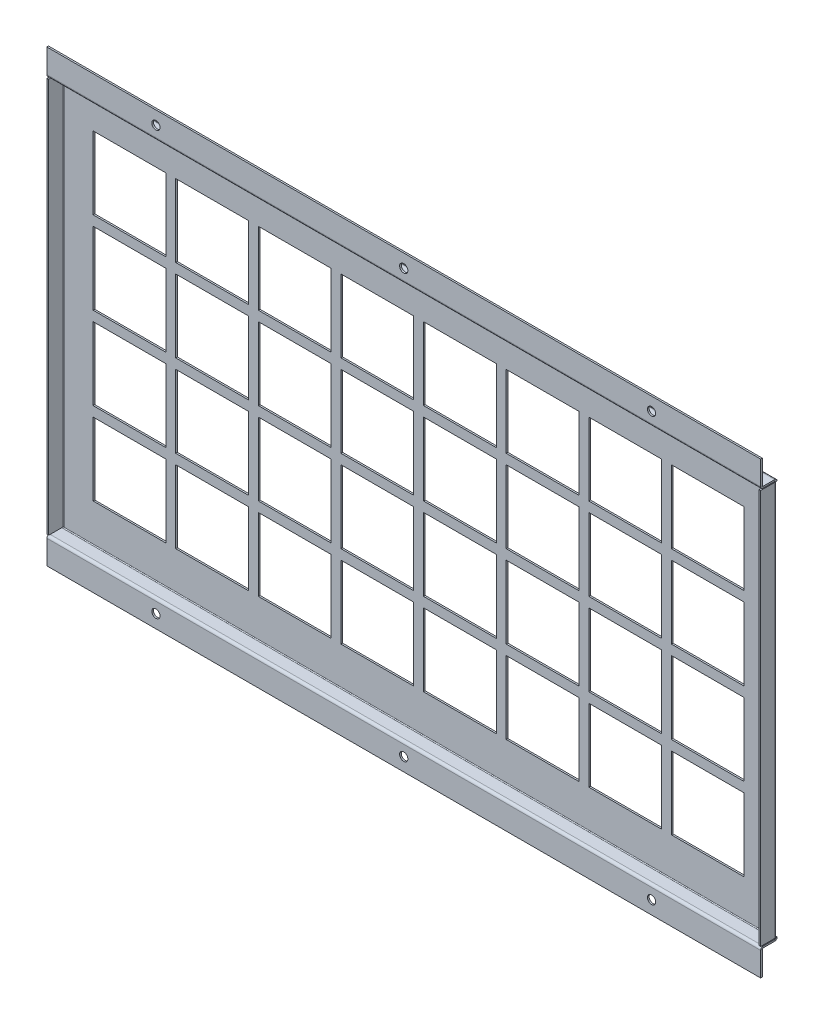
from build123d import *

# Parameters (mm, degrees)
SKETCH_1_W                       = 432
SKETCH_1_H                       = 242
SM_BASE_FLANGE_1_DEPTH           = 1
SKETCH_3_W                       = 44
SKETCH_3_H                       = 44
CUT_EXTRUDE_1_DEPTH              = 248.584329068
PATTERN_LINEAR_1_COUNT           = 8
PATTERN_LINEAR_1_PITCH           = 50
PATTERN_LINEAR_1_COUNT_DIR2      = 4
PATTERN_LINEAR_1_PITCH_DIR2      = 50
OTHER_START                      = -216
OTHER_1_DEPTH                    = 432
OTHER_1_2_DEPTH                  = 432
SKETCH_8_R                       = 2.5
CUT_EXTRUDE_2_DEPTH              = 256.407517509
SM_EDGE_FLANGE_1_STRIP_W         = 5
SM_EDGE_FLANGE_1_STRIP_H         = 1
SM_EDGE_FLANGE_1_STRIP_CUT_DEPTH = 239
SM_EDGE_FLANGE_1_DEPTH           = 239
SM_EDGE_FLANGE_2_STRIP_W         = 5
SM_EDGE_FLANGE_2_STRIP_H         = 1
SM_EDGE_FLANGE_2_STRIP_CUT_DEPTH = 239
SM_EDGE_FLANGE_2_DEPTH           = 239


# Read off the part's stored shape, not the designer's step: 斜接法兰1
# Sheet-metal steps are written as plain solids
with BuildPart() as part:
    # Sketch 1 → 基体-法兰1 (new body)
    with BuildSketch(Plane.XY):
        Rectangle(SKETCH_1_W, SKETCH_1_H)
    extrude(amount=-SM_BASE_FLANGE_1_DEPTH)

    # 草图3 → 切除-拉伸1 (cut, through all)
    with BuildSketch(Plane.XY):
        with Locations((-175, -74.98)):
            Rectangle(SKETCH_3_W, SKETCH_3_H)
    cut_extrude_1 = extrude(amount=-CUT_EXTRUDE_1_DEPTH, mode=Mode.SUBTRACT)

    # 阵列(线性)1: Cut-Extrude 1 8 × 4
    with Locations(*[(i * PATTERN_LINEAR_1_PITCH, j * PATTERN_LINEAR_1_PITCH_DIR2, 0) for i in range(PATTERN_LINEAR_1_COUNT) for j in range(PATTERN_LINEAR_1_COUNT_DIR2) if (i, j) != (0, 0)]):
        add(cut_extrude_1, mode=Mode.SUBTRACT)

    # Other 1 outline → Other 1 (cut)
    with BuildSketch(Plane.YZ.offset(OTHER_START)):
        with BuildLine():
            Line((121, 0), (120.914213563, 0))
            ThreePointArc((120.914213563, 0), (120.366025404, -0.724744872), (119.5, -1))
            Line((119.5, -1), (121, -1))
            Line((121, -1), (121, 0))
        make_face()
    other_1 = extrude(amount=OTHER_1_DEPTH, mode=Mode.SUBTRACT)

    # Other 1 2 outline → Other 1 2 (add)
    with BuildSketch(Plane.YZ.offset(OTHER_START)):
        with BuildLine():
            Line((121.5, 8), (136, 8))
            Line((136, 8), (136, 9))
            Line((136, 9), (121.5, 9))
            ThreePointArc((121.5, 9), (120.439339828, 8.560660172), (120, 7.5))
            Line((120, 7.5), (120, 0.5))
            ThreePointArc((120, 0.5), (119.853553391, 0.146446609), (119.5, 0))
            Line((119.5, 0), (120.914213563, 0))
            ThreePointArc((120.914213563, 0), (120.97839784, 0.246347032), (121, 0.5))
            Line((121, 0.5), (121, 7.5))
            ThreePointArc((121, 7.5), (121.146446609, 7.853553391), (121.5, 8))
        make_face()
    other_1_2 = extrude(amount=OTHER_1_2_DEPTH)

    # 草图8 → 切除-拉伸2 (cut, through all)
    with BuildSketch(Plane(origin=(0, 0, 8), x_dir=(-1, 0, 0), z_dir=(0, 0, -1))):
        with Locations((0, 128)):
            Circle(SKETCH_8_R)
        with Locations((150, 128)):
            Circle(SKETCH_8_R)
        with Locations((-150, 128)):
            Circle(SKETCH_8_R)
    cut_extrude_2 = extrude(amount=-CUT_EXTRUDE_2_DEPTH, mode=Mode.SUBTRACT)

    # 镜向1: Other 1, Other 1 2, 切除-拉伸2 across plane
    add(other_1.mirror(Plane.ZX), mode=Mode.SUBTRACT)
    add(other_1_2.mirror(Plane.ZX))
    add(cut_extrude_2.mirror(Plane.ZX), mode=Mode.SUBTRACT)

    # 边线-法兰1 strip (across the edge) → 边线-法兰1 strip cut (cut)
    with BuildSketch(Plane(origin=(-216, 119.5, 0), x_dir=(1, 0, 0), z_dir=(0, -1, 0))):
        with Locations((-1, -0.5)):
            Rectangle(SM_EDGE_FLANGE_1_STRIP_W, SM_EDGE_FLANGE_1_STRIP_H)
    extrude(amount=SM_EDGE_FLANGE_1_STRIP_CUT_DEPTH, mode=Mode.SUBTRACT)

    # 边线-法兰1 section (across the edge) → 边线-法兰1 (add)
    with BuildSketch(Plane(origin=(-216, 119.5, 0), x_dir=(1, 0, 0), z_dir=(0, -1, 0))):
        with BuildLine():
            Line((0, 0.5), (0, 9))
            Line((0, 9), (1, 9))
            Line((1, 9), (1, 0.5))
            ThreePointArc((1, 0.5), (1.146446609, 0.146446609), (1.5, 0))
            Line((1.5, 0), (1.5, -1))
            ThreePointArc((1.5, -1), (0.439339828, -0.560660172), (0, 0.5))
        make_face()
    extrude(amount=SM_EDGE_FLANGE_1_DEPTH)

    # 边线-法兰2 strip (across the edge) → 边线-法兰2 strip cut (cut)
    with BuildSketch(Plane(origin=(216, -119.5, 0), x_dir=(-1, 0, 0), z_dir=(0, 1, 0))):
        with Locations((-1, -0.5)):
            Rectangle(SM_EDGE_FLANGE_2_STRIP_W, SM_EDGE_FLANGE_2_STRIP_H)
    extrude(amount=SM_EDGE_FLANGE_2_STRIP_CUT_DEPTH, mode=Mode.SUBTRACT)

    # 边线-法兰2 section (across the edge) → 边线-法兰2 (add)
    with BuildSketch(Plane(origin=(216, -119.5, 0), x_dir=(-1, 0, 0), z_dir=(0, 1, 0))):
        with BuildLine():
            Line((0, 0.5), (0, 9))
            Line((0, 9), (1, 9))
            Line((1, 9), (1, 0.5))
            ThreePointArc((1, 0.5), (1.146446609, 0.146446609), (1.5, 0))
            Line((1.5, 0), (1.5, -1))
            ThreePointArc((1.5, -1), (0.439339828, -0.560660172), (0, 0.5))
        make_face()
    extrude(amount=SM_EDGE_FLANGE_2_DEPTH)


solid = part.part
